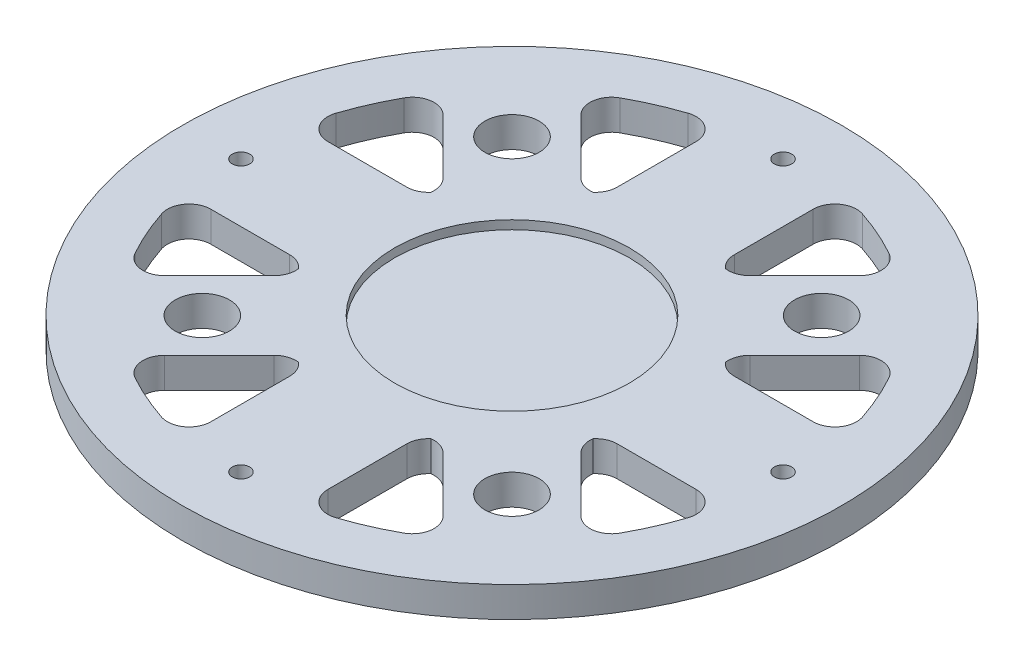
from build123d import *

# Parameters (mm, degrees)
SKETCH1_R           = 76
SKETCH1_R_2         = 27.051
SKETCH1_R_3         = 2
BOSS_EXTRUDE1_DEPTH = 7
SKETCH3_R           = 27.051
BOSS_EXTRUDE2_DEPTH = 5
SKETCH4_R           = 6.25
CUT_EXTRUDE1_DEPTH  = 10
FILLET1_R           = 5


with BuildPart() as part:
    # Sketch1 → Boss-Extrude1 (new body)
    with BuildSketch(Plane(origin=(0, 0, 0), x_dir=(1, 0, 0), z_dir=(0, 1, 0))):
        with Locations(Location((0, 0, 0), (0, 0, 270))):
            Circle(SKETCH1_R)
        with Locations(Location((0, 0, 0), (0, 0, 270))):
            Circle(SKETCH1_R_2, mode=Mode.SUBTRACT)
        with Locations(Location((0, 62.5, 0), (0, 0, 270))):
            Circle(SKETCH1_R_3, mode=Mode.SUBTRACT)
        with Locations(Location((62.5, 0, 0), (0, 0, 270))):
            Circle(SKETCH1_R_3, mode=Mode.SUBTRACT)
        with Locations(Location((0, -62.5, 0), (0, 0, 270))):
            Circle(SKETCH1_R_3, mode=Mode.SUBTRACT)
        with Locations(Location((-62.5, 0, 0), (0, 0, 270))):
            Circle(SKETCH1_R_3, mode=Mode.SUBTRACT)
    extrude(amount=BOSS_EXTRUDE1_DEPTH)

    # Sketch3 → Boss-Extrude2 (add)
    with BuildSketch(Plane.XZ):
        with Locations(Location((0, 0, 0), (0, 0, 270))):
            Circle(SKETCH3_R)
    extrude(amount=-BOSS_EXTRUDE2_DEPTH)

    # Sketch4 → Cut-Extrude1 (cut)
    with BuildSketch(Plane(origin=(0, 7, 0), x_dir=(1, 0, 0), z_dir=(0, 1, 0))):
        with BuildLine():
            Line((27.751246841, -43.661149418), (17.007161012, -32.917063589))
            ThreePointArc((17.007161012, -32.917063589), (15.274204293, -33.756114768), (13.5, -34.504008477))
            Line((13.5, -34.504008477), (13.5, -62.5))
            ThreePointArc((13.5, -62.5), (25.524772494, -58.625813335), (36.553123822, -52.463026398))
            Line((36.553123822, -52.463026398), (27.751246841, -43.661149418))
        make_face()
        with BuildLine():
            Line((62.5, -13.5), (34.504008477, -13.5))
            ThreePointArc((34.504008477, -13.5), (33.756114768, -15.274204293), (32.917063589, -17.007161012))
            Line((32.917063589, -17.007161012), (43.66114941, -27.751246833))
            Line((43.66114941, -27.751246833), (52.463026398, -36.553123822))
            ThreePointArc((52.463026398, -36.553123822), (58.625813335, -25.524772494), (62.5, -13.5))
        make_face()
        with BuildLine():
            ThreePointArc((-13.5, -34.504008477), (-15.274204293, -33.756114768), (-17.007161012, -32.917063589))
            Line((-17.007161012, -32.917063589), (-27.751246874, -43.66114945))
            Line((-27.751246874, -43.66114945), (-36.553123822, -52.463026398))
            ThreePointArc((-36.553123822, -52.463026398), (-25.524772494, -58.625813335), (-13.5, -62.5))
            Line((-13.5, -62.5), (-13.5, -34.504008477))
        make_face()
        with BuildLine():
            ThreePointArc((-32.917063589, -17.007161012), (-33.756114768, -15.274204293), (-34.504008477, -13.5))
            Line((-34.504008477, -13.5), (-62.5, -13.5))
            ThreePointArc((-62.5, -13.5), (-58.625813335, -25.524772494), (-52.463026398, -36.553123822))
            Line((-52.463026398, -36.553123822), (-43.661149471, -27.751246894))
            Line((-43.661149471, -27.751246894), (-32.917063589, -17.007161012))
        make_face()
        with BuildLine():
            ThreePointArc((-34.504008477, 13.5), (-33.756114768, 15.274204293), (-32.917063589, 17.007161012))
            Line((-32.917063589, 17.007161012), (-43.66114943, 27.751246854))
            Line((-43.66114943, 27.751246854), (-52.463026398, 36.553123822))
            ThreePointArc((-52.463026398, 36.553123822), (-58.625813335, 25.524772494), (-62.5, 13.5))
            Line((-62.5, 13.5), (-34.504008477, 13.5))
        make_face()
        with BuildLine():
            ThreePointArc((-17.007161012, 32.917063589), (-15.274204293, 33.756114768), (-13.5, 34.504008477))
            Line((-13.5, 34.504008477), (-13.5, 62.5))
            ThreePointArc((-13.5, 62.5), (-25.524772494, 58.625813335), (-36.553123822, 52.463026398))
            Line((-36.553123822, 52.463026398), (-27.751246874, 43.66114945))
            Line((-27.751246874, 43.66114945), (-17.007161012, 32.917063589))
        make_face()
        with BuildLine():
            ThreePointArc((36.553123822, 52.463026398), (25.524772494, 58.625813335), (13.5, 62.5))
            Line((13.5, 62.5), (13.5, 34.504008477))
            ThreePointArc((13.5, 34.504008477), (15.274204293, 33.756114768), (17.007161012, 32.917063589))
            Line((17.007161012, 32.917063589), (27.751246906, 43.661149483))
            Line((27.751246906, 43.661149483), (36.553123822, 52.463026398))
        make_face()
        with BuildLine():
            ThreePointArc((62.5, 13.5), (58.625813335, 25.524772494), (52.463026398, 36.553123822))
            Line((52.463026398, 36.553123822), (43.66114945, 27.751246874))
            Line((43.66114945, 27.751246874), (32.917063589, 17.007161012))
            ThreePointArc((32.917063589, 17.007161012), (33.756114768, 15.274204293), (34.504008477, 13.5))
            Line((34.504008477, 13.5), (62.5, 13.5))
        make_face()
        with Locations(Location((35.706198162, 35.706198162, 0), (0, 0, 270))):
            Circle(SKETCH4_R)
        with Locations(Location((35.706198162, -35.706198162, 0), (0, 0, 270))):
            Circle(SKETCH4_R)
        with Locations(Location((-35.706198162, -35.706198162, 0), (0, 0, 270))):
            Circle(SKETCH4_R)
        with Locations(Location((-35.706198162, 35.706198162, 0), (0, 0, 270))):
            Circle(SKETCH4_R)
    extrude(amount=-CUT_EXTRUDE1_DEPTH, mode=Mode.SUBTRACT)

    # Fillet1
    # the kernel refuses this fillet: 5 mm, written as the material it adds along each edge
    with BuildSketch(Plane(origin=(34.504008477, 7, 13.5), x_dir=(1, 0, 0), z_dir=(0, -1, 0)), Plane(origin=(13.5, 7, -34.504008477), x_dir=(0, 0, -1), z_dir=(0, -1, 0)), Plane(origin=(-34.504008477, 7, -13.5), x_dir=(-1, 0, 0), z_dir=(0, -1, 0)), Plane(origin=(-13.5, 7, 34.504008477), x_dir=(0, 0, 1), z_dir=(0, -1, 0))) as fillet1_piece_1:
        with BuildLine():
            CenterArc((3.258891319, 5), FILLET1_R, 206.100178987, 63.899821013)
            ThreePointArc((-1.231239688, 2.800290124), (-0.586707725, 1.412857227), (0, 0))
            Line((0, 0), (3.258891319, 0))
        make_face()
    extrude(amount=7)
    with BuildSketch(Plane(origin=(62.5, 7, 13.5), x_dir=(-1, 0, 0), z_dir=(0, -1, 0))) as fillet1_piece_2:
        with BuildLine():
            CenterArc((6.537189081, -5), FILLET1_R, 90, 108.2926811)
            ThreePointArc((1.789861186, -6.569355874), (0.807426008, -3.308519097), (0, 0))
            Line((0, 0), (6.537189081, 0))
        make_face()
    extrude(amount=7)
    with BuildSketch(Plane(origin=(52.463026398, 7, 36.553123822), x_dir=(-0.7071067811865521, 0, -0.707106781186543), z_dir=(0, -1, 0)), Plane(origin=(-36.553123822, 7, 52.463026398), x_dir=(0.7071067811865515, 0, -0.7071067811865436), z_dir=(0, -1, 0))) as fillet1_piece_3:
        with BuildLine():
            CenterArc((6.286852353, 5), FILLET1_R, 163.996405934, 106.003594066)
            ThreePointArc((1.480630334, 6.378488268), (0.658610883, 3.208210045), (0, 0))
            Line((0, 0), (6.286852353, 0))
        make_face()
    extrude(amount=7)
    with BuildSketch(Plane(origin=(32.917063589, 7, 17.007161012), x_dir=(0.4193809358930841, 0, -0.907810349472532), z_dir=(0, -1, 0)), Plane(origin=(17.007161012, 7, -32.917063589), x_dir=(-0.9078103494725283, 0, -0.41938093589309267), z_dir=(0, -1, 0)), Plane(origin=(-32.917063589, 7, -17.007161012), x_dir=(-0.4193809358930852, 0, 0.9078103494725317), z_dir=(0, -1, 0))) as fillet1_piece_4:
        with BuildLine():
            CenterArc((3.489548398, 4.995132399), FILLET1_R, 200.204490443, 67.267112024)
            Line((-1.202781391, 3.268273647), (0, 0))
            ThreePointArc((0, 0), (1.634487847, 0.036069898), (3.268975694, 0))
        make_face()
    extrude(amount=7)
    with BuildSketch(Plane(origin=(32.917063589, 7, -17.007161012), x_dir=(0.7071067811865526, 0, -0.7071067811865425), z_dir=(0, -1, 0)), Plane(origin=(-17.007161012, 7, -32.917063589), x_dir=(-0.7071067811865506, 0, -0.7071067811865445), z_dir=(0, -1, 0)), Plane(origin=(-32.917063589, 7, 17.007161012), x_dir=(-0.7071067811865506, 0, 0.7071067811865445), z_dir=(0, -1, 0)), Plane(origin=(17.007161012, 7, 32.917063589), x_dir=(0.7071067811865501, 0, 0.707106781186545), z_dir=(0, -1, 0))) as fillet1_piece_5:
        with BuildLine():
            CenterArc((3.482570273, 5), FILLET1_R, 202.732887976, 67.267112024)
            ThreePointArc((-1.129011858, 3.067822406), (-0.530655558, 1.546368727), (0, 0))
            Line((0, 0), (3.482570273, 0))
        make_face()
    extrude(amount=7)
    with BuildSketch(Plane(origin=(34.504008477, 7, -13.5), x_dir=(1, 0, 0), z_dir=(0, -1, 0))) as fillet1_piece_6:
        with BuildLine():
            CenterArc((3.258891319, -5), FILLET1_R, 90, 63.899821013)
            ThreePointArc((-1.231239688, -2.800290124), (-0.586707725, -1.412857227), (0, 0))
            Line((0, 0), (3.258891319, 0))
        make_face()
    extrude(amount=7)
    with BuildSketch(Plane(origin=(62.5, 7, -13.5), x_dir=(-1, 0, 0), z_dir=(0, -1, 0)), Plane(origin=(-13.5, 7, -62.5), x_dir=(0, 0, 1), z_dir=(0, -1, 0)), Plane(origin=(-62.5, 7, 13.5), x_dir=(1, 0, 0), z_dir=(0, -1, 0)), Plane(origin=(13.5, 7, 62.5), x_dir=(0, 0, -1), z_dir=(0, -1, 0))) as fillet1_piece_7:
        with BuildLine():
            CenterArc((6.537189081, 5), FILLET1_R, 161.7073189, 108.2926811)
            ThreePointArc((1.789861186, 6.569355874), (0.807426008, 3.308519097), (0, 0))
            Line((0, 0), (6.537189081, 0))
        make_face()
    extrude(amount=7)
    with BuildSketch(Plane(origin=(52.463026398, 7, -36.553123822), x_dir=(0.5289042688396526, 0, 0.848681491728901), z_dir=(0, -1, 0))) as fillet1_piece_8:
        with BuildLine():
            CenterArc((6.292063112, 4.993441128), FILLET1_R, 166.931450544, 106.003594066)
            Line((1.421561948, 6.124024341), (0, 0))
            ThreePointArc((0, 0), (3.274041034, -0.08387667), (6.548082068, 0))
        make_face()
    extrude(amount=7)
    with BuildSketch(Plane(origin=(36.553123822, 7, -52.463026398), x_dir=(-0.8486814917288963, 0, -0.52890426883966), z_dir=(0, -1, 0)), Plane(origin=(-52.463026398, 7, -36.553123822), x_dir=(-0.5289042688396536, 0, 0.8486814917289003), z_dir=(0, -1, 0))) as fillet1_piece_9:
        with BuildLine():
            CenterArc((6.292063112, -4.993441128), FILLET1_R, 87.06495539, 106.003594066)
            Line((1.421561948, -6.124024341), (0, 0))
            ThreePointArc((0, 0), (3.274041034, 0.08387667), (6.548082068, 0))
        make_face()
    extrude(amount=7)
    with BuildSketch(Plane(origin=(13.5, 7, -62.5), x_dir=(0.9648302017860143, 0, 0.26287388938720957), z_dir=(0, -1, 0)), Plane(origin=(-62.5, 7, -13.5), x_dir=(0.2628738893872084, 0, -0.9648302017860146), z_dir=(0, -1, 0)), Plane(origin=(-13.5, 7, 62.5), x_dir=(-0.9648302017860145, 0, -0.26287388938720885), z_dir=(0, -1, 0))) as fillet1_piece_10:
        with BuildLine():
            CenterArc((6.542607328, 4.992908013), FILLET1_R, 164.759342849, 108.2926811)
            Line((1.718456319, 6.30727746), (0, 0))
            ThreePointArc((0, 0), (3.404410363, -0.090694285), (6.808820725, 0))
        make_face()
    extrude(amount=7)
    with BuildSketch(Plane(origin=(-36.553123822, 7, -52.463026398), x_dir=(0.707106781186552, 0, 0.7071067811865429), z_dir=(0, -1, 0)), Plane(origin=(-52.463026398, 7, 36.553123822), x_dir=(0.7071067811865515, 0, -0.7071067811865436), z_dir=(0, -1, 0)), Plane(origin=(36.553123822, 7, 52.463026398), x_dir=(-0.7071067811865527, 0, -0.7071067811865425), z_dir=(0, -1, 0))) as fillet1_piece_11:
        with BuildLine():
            CenterArc((6.286852353, -5), FILLET1_R, 90, 106.003594066)
            ThreePointArc((1.480630334, -6.378488268), (0.658610883, -3.208210045), (0, 0))
            Line((0, 0), (6.286852353, 0))
        make_face()
    extrude(amount=7)
    with BuildSketch(Plane(origin=(-13.5, 7, -34.504008477), x_dir=(-0.9154220062230544, 0, 0.4024954043496127), z_dir=(0, -1, 0)), Plane(origin=(-34.504008477, 7, 13.5), x_dir=(0.4024954043496181, 0, 0.915422006223052), z_dir=(0, -1, 0)), Plane(origin=(13.5, 7, 34.504008477), x_dir=(0.915422006223051, 0, -0.40249540434962), z_dir=(0, -1, 0))) as fillet1_piece_12:
        with BuildLine():
            CenterArc((3.265421252, 4.995737851), FILLET1_R, 203.734271223, 63.899821013)
            Line((-1.311688779, 2.983260829), (0, 0))
            ThreePointArc((0, 0), (1.52950776, 0.031583378), (3.059015519, 0))
        make_face()
    extrude(amount=7)
    with BuildSketch(Plane(origin=(-17.007161012, 7, 32.917063589), x_dir=(-0.7071067811865496, 0, 0.7071067811865455), z_dir=(0, -1, 0))) as fillet1_piece_13:
        with BuildLine():
            CenterArc((3.482570273, -5), FILLET1_R, 90, 67.267112024)
            ThreePointArc((-1.129011858, -3.067822406), (-0.530655558, -1.546368727), (0, 0))
            Line((0, 0), (3.482570273, 0))
        make_face()
    extrude(amount=7)


solid = part.part
